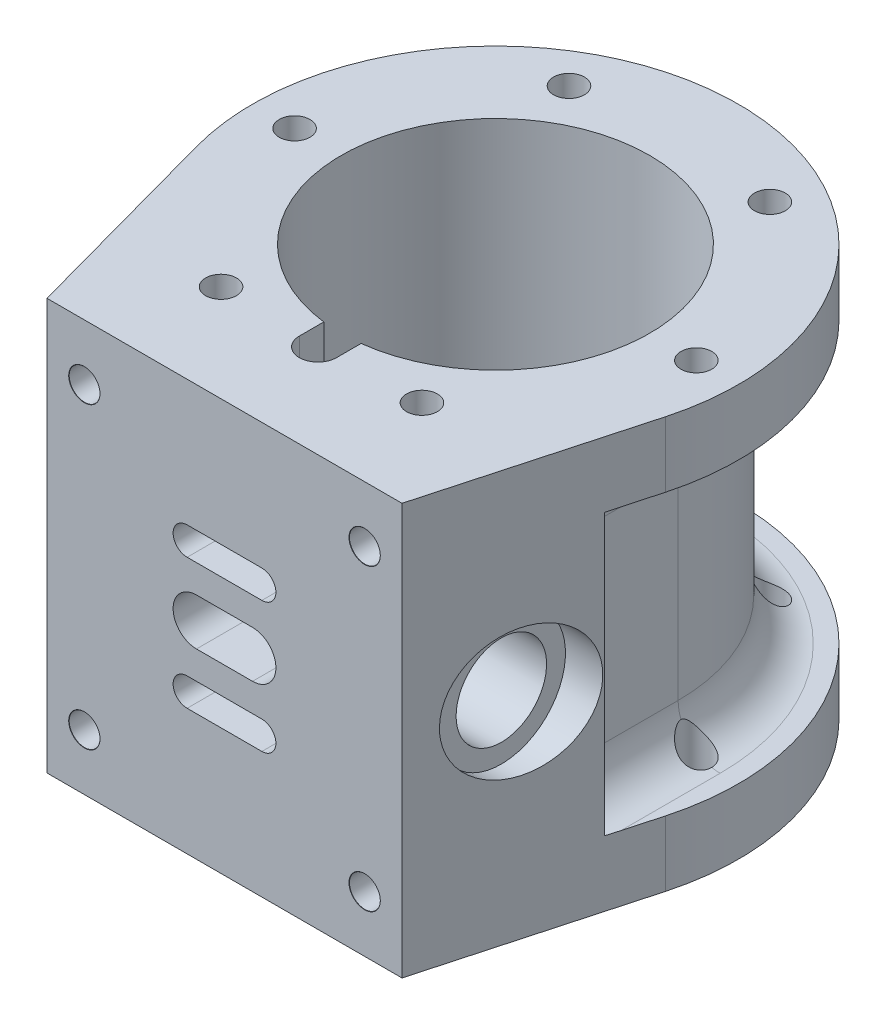
from build123d import *

# Parameters (mm, degrees)
SKETCH1_R                             = 16.5
BOSS_EXTRUDE2_DEPTH                   = 22
CUT_EXTRUDE1_DEPTH                    = 15
HOLE1_AT_2_COUNT                      = 2
HOLE1_AT_2_PITCH                      = 21.5
HOLE1_AT_3_COUNT                      = 2
HOLE1_AT_3_PITCH                      = 21.5
HOLE1_AT_4_COUNT                      = 2
HOLE1_AT_4_PITCH                      = 31.500888828
HOLE1_AT_5_COUNT                      = 2
HOLE1_AT_5_PITCH                      = 37.239092363
HOLE1_AT_6_COUNT                      = 2
HOLE1_AT_6_PITCH                      = 43
HOLE1_AT_7_COUNT                      = 2
HOLE1_AT_7_PITCH                      = 37.239092363
HOLE1_AT_8_COUNT                      = 2
HOLE1_AT_8_PITCH                      = 69.083331562
CUT_EXTRUDE2_DEPTH                    = 59.762232769
TAP_DRILL_FOR_M4X0_7_TAP2_D           = 3.3
TAP_DRILL_FOR_M4X0_7_TAP2_DEPTH       = 7.008579979
TAP_DRILL_FOR_M4X0_7_TAP2_CSINK_D     = 3.35
TAP_DRILL_FOR_M4X0_7_TAP2_CSINK_ANGLE = 90
TAP_DRILL_FOR_M4X0_7_TAP2_TIP         = 0.991420021
FILLET1_R                             = 4.5
CUT_EXTRUDE3_DEPTH                    = 12
CUT_EXTRUDE4_DEPTH                    = 45.732538493
CUT_EXTRUDE4_DEPTH_BACK               = 45.732538493
SKETCH12_R                            = 2.5


with BuildPart() as part:
    # Sketch1 → Boss-Extrude2 (new, symmetric)
    with BuildSketch(Plane(origin=(0, 0, 0), x_dir=(1, 0, 0), z_dir=(0, 1, 0))):
        with BuildLine():
            Line((25.072176515, -6.883746421), (19, -29))
            Line((19, -29), (-19, -29))
            Line((-19, -29), (-25.072176515, -6.883746421))
            ThreePointArc((-25.072176515, -6.883746421), (0, 26), (25.072176515, -6.883746421))
        make_face()
        with Locations(Location((0, 0, 0), (0, 0, 270))):
            Circle(SKETCH1_R, mode=Mode.SUBTRACT)
    extrude(amount=BOSS_EXTRUDE2_DEPTH, both=True)

    # Sketch2 → Cut-Extrude1 (cut, symmetric)
    with BuildSketch(Plane(origin=(0, 0, 0), x_dir=(1, 0, 0), z_dir=(0, 1, 0))):
        with BuildLine():
            Line((-19.549114387, 0), (-19.549114387, -8.001751458))
            ThreePointArc((-19.549114387, -8.001751458), (-20.762847316, -10.871719368), (-23.667472291, -12))
            ThreePointArc((-23.667472291, -12), (0, 26.535810608), (23.667472291, -12))
            ThreePointArc((23.667472291, -12), (20.762847316, -10.871719368), (19.549114387, -8.001751458))
            Line((19.549114387, -8.001751458), (19.549114387, 0))
            ThreePointArc((19.549114387, 0), (0, 19.549114387), (-19.549114387, 0))
        make_face()
    extrude(amount=CUT_EXTRUDE1_DEPTH, both=True, mode=Mode.SUBTRACT)

    # Sketch5 → Hole1 (revolve, cut)
    with BuildSketch(Plane(origin=(-21.5, 22, 0), x_dir=(0, 0, 1), z_dir=(1, 0, 0))):
        Polygon((0, 0), (0, 10), (1.65, 9.008579979), (1.65, 0), align=None)
    hole1 = revolve(axis=Axis((-21.5, 28.35, 0), (0, -1, 0)), mode=Mode.SUBTRACT)

    # Hole1 at 2: Hole1 ×2
    with Locations(*[Vector(0.5000000000000024, 0, -0.8660254037844373) * (i * HOLE1_AT_2_PITCH) for i in range(1, HOLE1_AT_2_COUNT)]):
        add(hole1, mode=Mode.SUBTRACT)

    # Hole1 at 3: Hole1 ×2
    with Locations(*[Vector(0.5000000000000024, 0, 0.8660254037844373) * (i * HOLE1_AT_3_PITCH) for i in range(1, HOLE1_AT_3_COUNT)]):
        add(hole1, mode=Mode.SUBTRACT)

    # Hole1 at 4: Hole1 ×2
    with Locations(*[Vector(-0.7128631273730441, 0, -0.7013031880947947) * (i * HOLE1_AT_4_PITCH) for i in range(1, HOLE1_AT_4_COUNT)]):
        add(hole1, mode=Mode.SUBTRACT)

    # Hole1 at 5: Hole1 ×2
    with Locations(*[Vector(0.8660254037844373, 0, 0.5000000000000026) * (i * HOLE1_AT_5_PITCH) for i in range(1, HOLE1_AT_5_COUNT)]):
        add(hole1, mode=Mode.SUBTRACT)

    # Hole1 at 6: Hole1 ×2
    with Locations(*[(i * HOLE1_AT_6_PITCH, 0, 0) for i in range(1, HOLE1_AT_6_COUNT)]):
        add(hole1, mode=Mode.SUBTRACT)

    # Hole1 at 7: Hole1 ×2
    with Locations(*[Vector(0.8660254037844373, 0, -0.5000000000000026) * (i * HOLE1_AT_7_PITCH) for i in range(1, HOLE1_AT_7_COUNT)]):
        add(hole1, mode=Mode.SUBTRACT)

    # Hole1 at 8: Hole1 ×2
    with Locations(*[Vector(0.9474908150059002, 0, -0.3197829818477766) * (i * HOLE1_AT_8_PITCH) for i in range(1, HOLE1_AT_8_COUNT)]):
        add(hole1, mode=Mode.SUBTRACT)

    # Mirror1: Hole1 across plane
    add(hole1.mirror(Plane.ZX), mode=Mode.SUBTRACT)

    # Mirror1 copy 1 sketch → Mirror1 copy 1 (revolve, cut)
    with BuildSketch(Plane(origin=(-10.75, -22, -18.619546181), x_dir=(0, 0, 1), z_dir=(1, 0, 0))):
        Polygon((0, 0), (0, -10), (1.65, -9.008579979), (1.65, 0), align=None)
    revolve(axis=Axis((-10.75, -28.35, -18.619546181), (0, -1, 0)), mode=Mode.SUBTRACT)

    # Mirror1 copy 2 sketch → Mirror1 copy 2 (revolve, cut)
    with BuildSketch(Plane(origin=(-10.75, -22, 18.619546181), x_dir=(0, 0, 1), z_dir=(1, 0, 0))):
        Polygon((0, 0), (0, -10), (1.65, -9.008579979), (1.65, 0), align=None)
    revolve(axis=Axis((-10.75, -28.35, 18.619546181), (0, -1, 0)), mode=Mode.SUBTRACT)

    # Mirror1 copy 3 sketch → Mirror1 copy 3 (revolve, cut)
    with BuildSketch(Plane(origin=(-43.955822125, -22, -22.091673763), x_dir=(0, 0, 1), z_dir=(1, 0, 0))):
        Polygon((0, 0), (0, -10), (1.65, -9.008579979), (1.65, 0), align=None)
    revolve(axis=Axis((-43.955822125, -28.35, -22.091673763), (0, -1, 0)), mode=Mode.SUBTRACT)

    # Mirror1 copy 4 sketch → Mirror1 copy 4 (revolve, cut)
    with BuildSketch(Plane(origin=(10.75, -22, 18.619546181), x_dir=(0, 0, 1), z_dir=(1, 0, 0))):
        Polygon((0, 0), (0, -10), (1.65, -9.008579979), (1.65, 0), align=None)
    revolve(axis=Axis((10.75, -28.35, 18.619546181), (0, -1, 0)), mode=Mode.SUBTRACT)

    # Mirror1 copy 5 sketch → Mirror1 copy 5 (revolve, cut)
    with BuildSketch(Plane(origin=(21.5, -22, 0), x_dir=(0, 0, 1), z_dir=(1, 0, 0))):
        Polygon((0, 0), (0, -10), (1.65, -9.008579979), (1.65, 0), align=None)
    revolve(axis=Axis((21.5, -28.35, 0), (0, -1, 0)), mode=Mode.SUBTRACT)

    # Mirror1 copy 6 sketch → Mirror1 copy 6 (revolve, cut)
    with BuildSketch(Plane(origin=(10.75, -22, -18.619546181), x_dir=(0, 0, 1), z_dir=(1, 0, 0))):
        Polygon((0, 0), (0, -10), (1.65, -9.008579979), (1.65, 0), align=None)
    revolve(axis=Axis((10.75, -28.35, -18.619546181), (0, -1, 0)), mode=Mode.SUBTRACT)

    # Mirror1 copy 7 sketch → Mirror1 copy 7 (revolve, cut)
    with BuildSketch(Plane(origin=(43.955822125, -22, -22.091673763), x_dir=(0, 0, 1), z_dir=(1, 0, 0))):
        Polygon((0, 0), (0, -10), (1.65, -9.008579979), (1.65, 0), align=None)
    revolve(axis=Axis((43.955822125, -28.35, -22.091673763), (0, -1, 0)), mode=Mode.SUBTRACT)

    # Sketch6 → Cut-Extrude2 (cut, through all)
    with BuildSketch(Plane(origin=(0, 22, 0), x_dir=(1, 0, 0), z_dir=(0, 1, 0))):
        with BuildLine():
            Line((1.997991915, -8.262434173), (1.997991915, -19))
            ThreePointArc((1.997991915, -19), (0, -20.997991915), (-1.997991915, -19))
            Line((-1.997991915, -19), (-1.997991915, -8.262434173))
            ThreePointArc((-1.997991915, -8.262434173), (0, -6.264442258), (1.997991915, -8.262434173))
        make_face()
    extrude(amount=-CUT_EXTRUDE2_DEPTH, mode=Mode.SUBTRACT)

    # Tap Drill for M4x0.7 Tap2
    with Locations(Plane.XY.offset(29)):
        with Locations((-15, 16), (15, 16), (15, -16), (-15, -16)):
            CounterSinkHole(TAP_DRILL_FOR_M4X0_7_TAP2_D / 2, TAP_DRILL_FOR_M4X0_7_TAP2_CSINK_D / 2, depth=TAP_DRILL_FOR_M4X0_7_TAP2_DEPTH, counter_sink_angle=TAP_DRILL_FOR_M4X0_7_TAP2_CSINK_ANGLE)
            with Locations((0, 0, -(TAP_DRILL_FOR_M4X0_7_TAP2_DEPTH + TAP_DRILL_FOR_M4X0_7_TAP2_TIP / 2))):  # 118° drill point
                Cone(0, TAP_DRILL_FOR_M4X0_7_TAP2_D / 2, TAP_DRILL_FOR_M4X0_7_TAP2_TIP, mode=Mode.SUBTRACT)

    # Fillet1
    # the kernel refuses this fillet: 4.5 mm, written as the material it adds along each edge
    with BuildSketch(Plane(origin=(-19.549114387, 15, 0), x_dir=(0, -1, 0), z_dir=(0, 0, 1))) as fillet1_piece_1_section:
        with BuildLine():
            CenterArc((FILLET1_R, -FILLET1_R), FILLET1_R, 90, 90)
            Line((0, -FILLET1_R), (0, 0))
            Line((0, 0), (FILLET1_R, 0))
        make_face()
    fillet1_piece_1 = extrude(amount=19.251751458, mode=Mode.PRIVATE)
    fillet1_piece_1 = split(fillet1_piece_1, bisect_by=Plane(origin=(-25.637789582, 13.825048866, 4.823654464), z_dir=(0.9643144813547617, 0, -0.26475947773308706)), keep=Keep.TOP, mode=Mode.PRIVATE)
    fillet1_piece_1 = fillet1_piece_1 - Plane(origin=(-21.5, 13.825048866, 0), x_dir=(0, 0, 1), z_dir=(0, 1, 0)) * Cylinder(1.65, 57, mode=Mode.PRIVATE)
    with BuildSketch(Plane(origin=(0, 15, 0), x_dir=(1, 0, 0), z_dir=(0, 0, 1))) as fillet1_piece_2_section:
        with BuildLine():
            CenterArc((19.549114387 + FILLET1_R, -FILLET1_R), FILLET1_R, 90, 90)
            Line((19.549114387 + FILLET1_R, 0), (19.549114387, 0))
            Line((19.549114387, 0), (19.549114387, -FILLET1_R))
        make_face()
    fillet1_piece_2 = revolve(axis=Axis((0, 15, 0), (0, 1, 0)), revolution_arc=180, mode=Mode.PRIVATE)
    fillet1_piece_2 = fillet1_piece_2 - Plane(origin=(-10.75, 13.72424565, -18.619546181), x_dir=(0, 0, 1), z_dir=(0, 1, 0)) * Cylinder(1.65, 97, mode=Mode.PRIVATE)
    fillet1_piece_2 = fillet1_piece_2 - Plane(origin=(-21.5, 13.72424565, 0), x_dir=(0, 0, 1), z_dir=(0, 1, 0)) * Cylinder(1.65, 97, mode=Mode.PRIVATE)
    fillet1_piece_2 = fillet1_piece_2 - Plane(origin=(10.75, 13.72424565, -18.619546181), x_dir=(0, 0, 1), z_dir=(0, 1, 0)) * Cylinder(1.65, 97, mode=Mode.PRIVATE)
    fillet1_piece_2 = fillet1_piece_2 - Plane(origin=(21.5, 13.72424565, 0), x_dir=(0, 0, 1), z_dir=(0, 1, 0)) * Cylinder(1.65, 97, mode=Mode.PRIVATE)
    with BuildSketch(Plane(origin=(19.549114387, 15, 19.251751458), x_dir=(0, -1, 0), z_dir=(0, 0, -1))) as fillet1_piece_3_section:
        with BuildLine():
            CenterArc((FILLET1_R, -FILLET1_R), FILLET1_R, 90, 90)
            Line((0, -FILLET1_R), (0, 0))
            Line((0, 0), (FILLET1_R, 0))
        make_face()
    fillet1_piece_3 = extrude(amount=19.251751458, mode=Mode.PRIVATE)
    fillet1_piece_3 = split(fillet1_piece_3, bisect_by=Plane(origin=(24.493050872, 14.216844882, 8.99305427), z_dir=(-0.9643144813547618, 0, -0.2647594777330867)), keep=Keep.TOP, mode=Mode.PRIVATE)
    fillet1_piece_3 = fillet1_piece_3 - Plane(origin=(21.5, 14.216844882, 0), x_dir=(0, 0, 1), z_dir=(0, 1, 0)) * Cylinder(1.65, 57, mode=Mode.PRIVATE)
    with BuildSketch(Plane(origin=(-19.549114387, -15, 0), x_dir=(0, 1, 0), z_dir=(0, 0, 1))) as fillet1_piece_4_section:
        with BuildLine():
            CenterArc((FILLET1_R, FILLET1_R), FILLET1_R, 180, 90)
            Line((0, FILLET1_R), (0, 0))
            Line((0, 0), (FILLET1_R, 0))
        make_face()
    fillet1_piece_4 = extrude(amount=19.251751458, mode=Mode.PRIVATE)
    fillet1_piece_4 = fillet1_piece_4 - Plane(origin=(-21.5, -13.825048866, 0), x_dir=(0, 0, 1), z_dir=(0, -1, 0)) * Cylinder(1.65, 57, mode=Mode.PRIVATE)
    fillet1_piece_4 = split(fillet1_piece_4, bisect_by=Plane(origin=(-25.637789582, -13.825048866, 4.823654464), z_dir=(0.9643144813547617, 0, -0.26475947773308706)), keep=Keep.TOP, mode=Mode.PRIVATE)
    with BuildSketch(Plane(origin=(0, -15, 0), x_dir=(1, 0, 0), z_dir=(0, 0, 1))) as fillet1_piece_5_section:
        with BuildLine():
            CenterArc((19.549114387 + FILLET1_R, FILLET1_R), FILLET1_R, 180, 90)
            Line((19.549114387 + FILLET1_R, 0), (19.549114387, 0))
            Line((19.549114387, 0), (19.549114387, FILLET1_R))
        make_face()
    fillet1_piece_5 = revolve(axis=Axis((0, -15, 0), (0, 1, 0)), revolution_arc=180, mode=Mode.PRIVATE)
    fillet1_piece_5 = fillet1_piece_5 - Plane(origin=(-10.75, -13.72424565, -18.619546181), x_dir=(0, 0, 1), z_dir=(0, -1, 0)) * Cylinder(1.65, 97, mode=Mode.PRIVATE)
    fillet1_piece_5 = fillet1_piece_5 - Plane(origin=(-21.5, -13.72424565, 0), x_dir=(0, 0, 1), z_dir=(0, -1, 0)) * Cylinder(1.65, 97, mode=Mode.PRIVATE)
    fillet1_piece_5 = fillet1_piece_5 - Plane(origin=(10.75, -13.72424565, -18.619546181), x_dir=(0, 0, 1), z_dir=(0, -1, 0)) * Cylinder(1.65, 97, mode=Mode.PRIVATE)
    fillet1_piece_5 = fillet1_piece_5 - Plane(origin=(21.5, -13.72424565, 0), x_dir=(0, 0, 1), z_dir=(0, -1, 0)) * Cylinder(1.65, 97, mode=Mode.PRIVATE)
    with BuildSketch(Plane(origin=(19.549114387, -15, 19.251751458), x_dir=(0, 1, 0), z_dir=(0, 0, -1))) as fillet1_piece_6_section:
        with BuildLine():
            CenterArc((FILLET1_R, FILLET1_R), FILLET1_R, 180, 90)
            Line((0, FILLET1_R), (0, 0))
            Line((0, 0), (FILLET1_R, 0))
        make_face()
    fillet1_piece_6 = extrude(amount=19.251751458, mode=Mode.PRIVATE)
    fillet1_piece_6 = split(fillet1_piece_6, bisect_by=Plane(origin=(24.493050872, -14.216844882, 8.99305427), z_dir=(-0.9643144813547618, 0, -0.2647594777330867)), keep=Keep.TOP, mode=Mode.PRIVATE)
    fillet1_piece_6 = fillet1_piece_6 - Plane(origin=(21.5, -14.216844882, 0), x_dir=(0, 0, 1), z_dir=(0, -1, 0)) * Cylinder(1.65, 57, mode=Mode.PRIVATE)
    add([fillet1_piece_1, fillet1_piece_2, fillet1_piece_3, fillet1_piece_4, fillet1_piece_5, fillet1_piece_6])

    # Sketch10 → Cut-Extrude3 (cut)
    with BuildSketch(Plane.XY.offset(29)):
        with BuildLine():
            Line((-3, 2.5), (3, 2.5))
            ThreePointArc((3, 2.5), (5.5, 0), (3, -2.5))
            Line((3, -2.5), (-3, -2.5))
            ThreePointArc((-3, -2.5), (-5.5, 0), (-3, 2.5))
        make_face()
        with BuildLine():
            Line((-4, -8.5), (4, -8.5))
            ThreePointArc((4, -8.5), (5.5, -7), (4, -5.5))
            Line((4, -5.5), (-4, -5.5))
            ThreePointArc((-4, -5.5), (-5.5, -7), (-4, -8.5))
        make_face()
        with BuildLine():
            Line((-4, 8.5), (4, 8.5))
            ThreePointArc((4, 8.5), (5.5, 7), (4, 5.5))
            Line((4, 5.5), (-4, 5.5))
            ThreePointArc((-4, 5.5), (-5.5, 7), (-4, 8.5))
        make_face()
    extrude(amount=-CUT_EXTRUDE3_DEPTH, mode=Mode.SUBTRACT)

    # Sketch12 → Cut-Extrude4 (cut, two sides: drawn at the far end of the back side and taken through both)
    with BuildSketch(Plane(origin=(0, 0, 0), x_dir=(0, 0, -1), z_dir=(1, 0, 0)).offset(-CUT_EXTRUDE4_DEPTH_BACK)):
        with Locations((-19, 0)):
            Circle(SKETCH12_R)
    extrude(amount=CUT_EXTRUDE4_DEPTH + CUT_EXTRUDE4_DEPTH_BACK, mode=Mode.SUBTRACT)

    # Sketch14 → Cut-Revolve1 (revolve, cut)
    with BuildSketch(Plane(origin=(0, 0, 0), x_dir=(1, 0, 0), z_dir=(0, 1, 0)), mode=Mode.PRIVATE) as cut_revolve1_sk:
        Polygon((23.628928916, -19), (23.628928916, -12.140383774), (19.628928916, -12.140383774), (19.628928916, -14.157688629), (11.628928916, -14.157688629), (11.628928916, -19), align=None)
    cut_revolve1 = revolve(cut_revolve1_sk.sketch.rotate(Axis((-29.849973083, 0, 19), (1, 0, 0)), 36.869897646), axis=Axis((-29.849973083, 0, 19), (1, 0, 0)), mode=Mode.SUBTRACT)

    # Mirror2: Cut-Revolve1 across plane
    add(cut_revolve1.mirror(Plane(origin=(0, 0, 0), x_dir=(0, 0, 1), z_dir=(1, 0, 0))), mode=Mode.SUBTRACT)


solid = part.part
